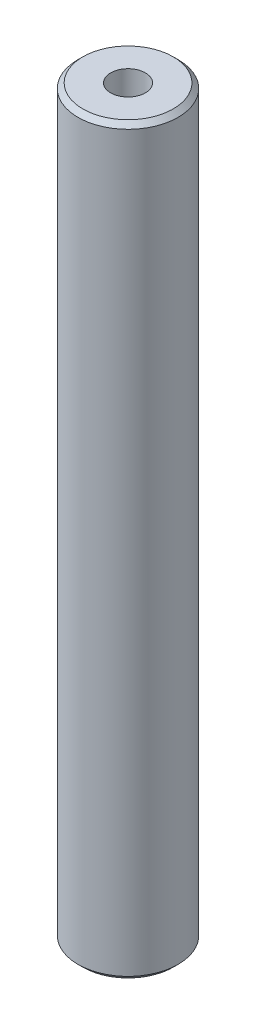
from build123d import *

# Parameters (mm, degrees)
SKETCH1_R           = 37.5
BOSS_EXTRUDE1_DEPTH = 556.93073576
SKETCH2_R           = 13.011952148
CUT_EXTRUDE1_DEPTH  = 560.450037478
CHAMFER1_SIZE       = 3.640178652


with BuildPart() as part:
    # Sketch1 → Boss-Extrude1 (new body)
    with BuildSketch(Plane(origin=(0, 0, 0), x_dir=(1, 0, 0), z_dir=(0, 1, 0))):
        Circle(SKETCH1_R)
    extrude(amount=BOSS_EXTRUDE1_DEPTH)

    # Sketch2 → Cut-Extrude1 (cut, through all)
    with BuildSketch(Plane(origin=(0, 0, 0), x_dir=(1, 0, 0), z_dir=(0, 1, 0))):
        Circle(SKETCH2_R)
    extrude(amount=CUT_EXTRUDE1_DEPTH, mode=Mode.SUBTRACT)

    # Chamfer1
    chamfer1_edges = [part.edges().sort_by_distance(p)[0] for p in [
        (-37.5, 556.93073576, 0),
        (-37.5, 0, 0),
    ]]
    chamfer(chamfer1_edges, length=CHAMFER1_SIZE)


solid = part.part
